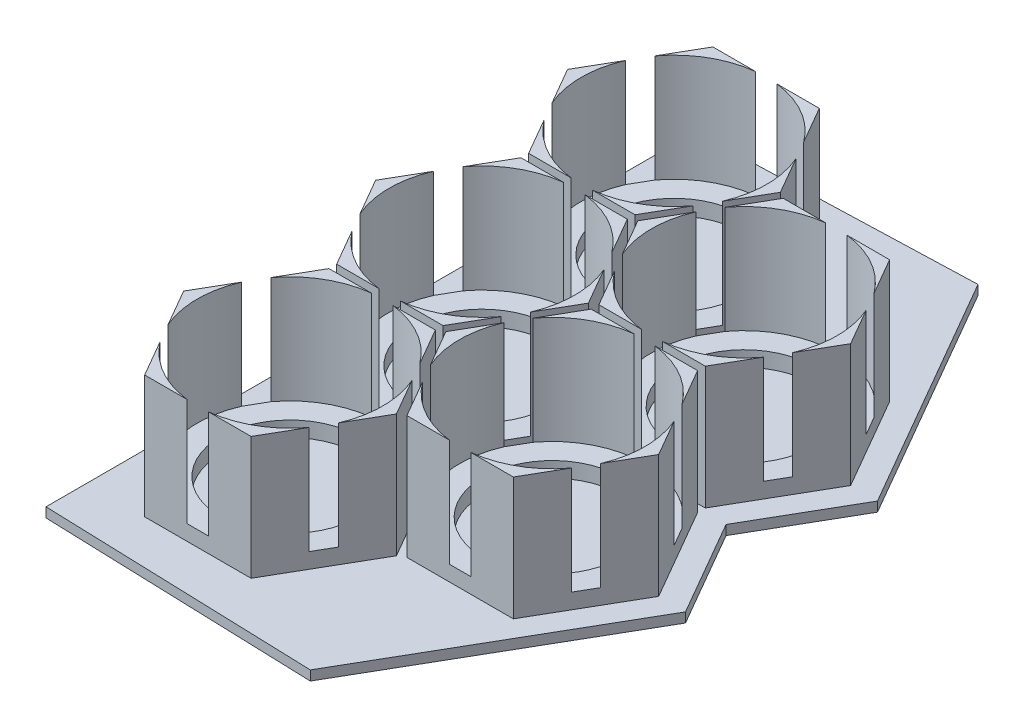
from build123d import *

# Parameters (mm, degrees)
BOSS_EXTRUDE1_DEPTH = 1
BOSS_EXTRUDE2_DEPTH = 25.4
SKETCH4_R           = 14.351
CUT_EXTRUDE1_DEPTH  = 25.4
SKETCH4_4_R         = 19.177
CUT_EXTRUDE2_DEPTH  = 22.225
LPATTERN1_COUNT     = 3
LPATTERN1_PITCH     = 78
SPLIT3_START        = -1
SPLIT3_DEPTH        = 27.4


# Read off the part's stored shape, not the designer's step: Split3
with BuildPart() as part:
    # Sketch1 → Boss-Extrude1 (new, symmetric)
    with BuildSketch(Plane(origin=(0, 0, 0), x_dir=(1, 0, 0), z_dir=(0, 1, 0))):
        Polygon((118, 0), (-118, 0), (-118, -67.135), (118, -75), align=None)
        Polygon((-118, 67.135), (-118, 0), (118, 0), (118, 75), align=None)
    extrude(amount=BOSS_EXTRUDE1_DEPTH, both=True)

    # Sketch3 → Boss-Extrude2 (add)
    with BuildSketch(Plane(origin=(0, 1, 0), x_dir=(1, 0, 0), z_dir=(0, 1, 0))):
        Polygon((-84.001477372, 20.6375), (-73.002954744, 39.6875), (-84.001477372, 58.7375), (-105.998522628, 58.7375), (-116.997045256, 39.6875), (-105.998522628, 20.6375), align=None)
        Polygon((-38.632571531, 19.84375), (-49.631094159, 0.79375), (-71.628139415, 0.79375), (-82.626662043, 19.84375), (-71.628139415, 38.89375), (-49.631094159, 38.89375), align=None)
        Polygon((-84.001477372, -19.05), (-73.002954744, 0), (-84.001477372, 19.05), (-105.998522628, 19.05), (-116.997045256, 0), (-105.998522628, -19.05), align=None)
        Polygon((-105.998522628, -58.7375), (-84.001477372, -58.7375), (-73.002954744, -39.6875), (-84.001477372, -20.6375), (-105.998522628, -20.6375), (-116.997045256, -39.6875), align=None)
        Polygon((-71.628139415, -38.89375), (-49.631094159, -38.89375), (-38.632571531, -19.84375), (-49.631094159, -0.79375), (-71.628139415, -0.79375), (-82.626662043, -19.84375), align=None)
    boss_extrude2 = extrude(amount=BOSS_EXTRUDE2_DEPTH)

    # Sketch4 → Cut-Extrude1 (cut)
    with BuildSketch(Plane(origin=(0, 26.4, 0), x_dir=(1, 0, 0), z_dir=(0, 1, 0))):
        with Locations(Location((-95, 0, 0), (0, 0, 270))):
            Circle(SKETCH4_R)
        with Locations(Location((-95, -39.6875, 0), (0, 0, 270))):
            Circle(SKETCH4_R)
        with Locations(Location((-95, 39.6875, 0), (0, 0, 90))):
            Circle(SKETCH4_R)
        with Locations(Location((-60.629616787, 19.84375, 0), (0, 0, 270))):
            Circle(SKETCH4_R)
        with Locations(Location((-60.629616787, -19.84375, 0), (0, 0, 90))):
            Circle(SKETCH4_R)
    cut_extrude1 = extrude(amount=-CUT_EXTRUDE1_DEPTH, mode=Mode.SUBTRACT)

    # Sketch4<4> → Cut-Extrude2 (cut)
    with BuildSketch(Plane(origin=(0, 26.4, 0), x_dir=(1, 0, 0), z_dir=(0, 1, 0))):
        with Locations((-95, 0)):
            Circle(SKETCH4_4_R)
        with Locations((-95, -39.6875)):
            Circle(SKETCH4_4_R)
        with Locations((-95, 39.6875)):
            Circle(SKETCH4_4_R)
        with Locations((-60.629616787, 19.84375)):
            Circle(SKETCH4_4_R)
        with Locations((-60.629616787, -19.84375)):
            Circle(SKETCH4_4_R)
    cut_extrude2 = extrude(amount=-CUT_EXTRUDE2_DEPTH, mode=Mode.SUBTRACT)

    # LPattern1: Boss-Extrude2, Cut-Extrude1, Cut-Extrude2 ×3
    with Locations(*[(i * LPATTERN1_PITCH, 0, 0) for i in range(1, LPATTERN1_COUNT)]):
        add(boss_extrude2)
        add(cut_extrude1, mode=Mode.SUBTRACT)
        add(cut_extrude2, mode=Mode.SUBTRACT)

    # Split3 outline → Split3 (cut)
    with BuildSketch(Plane(origin=(0, 0, 0), x_dir=(1, 0, 0), z_dir=(0, 1, 0)).offset(SPLIT3_START)):
        Polygon((-44.543205596, 0), (-33.086411192, -19.84375), (-61.477571296, -69.018681787), (118, -75), (118, 75), (-61.477571296, 69.018681787), (-33.086411192, 19.84375), align=None)
    extrude(amount=SPLIT3_DEPTH, mode=Mode.SUBTRACT)


solid = part.part
